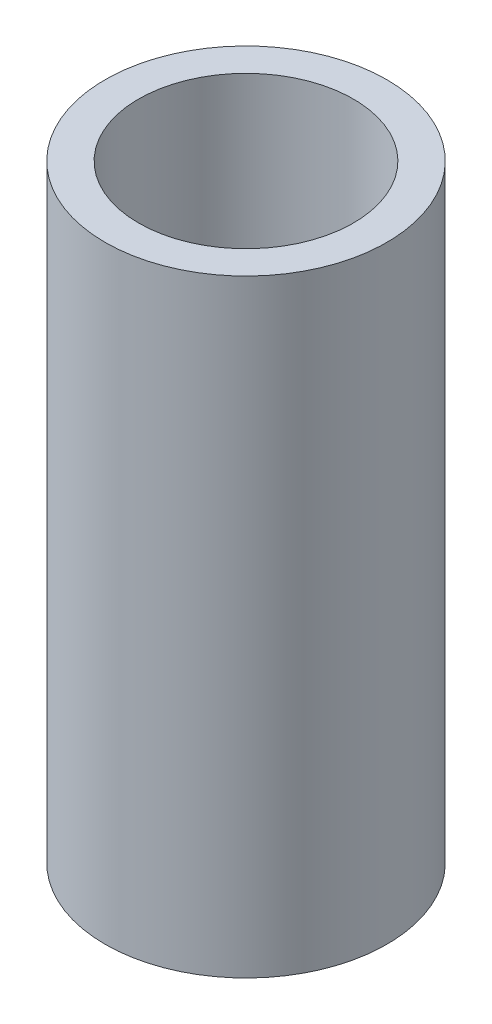
from build123d import *

# Parameters (mm, degrees)
SKETCH1_R           = 32.5
BOSS_EXTRUDE1_DEPTH = 140.209065321
SKETCH2_R           = 24.778336436
CUT_EXTRUDE1_DEPTH  = 148.550269394


with BuildPart() as part:
    # Sketch1 → Boss-Extrude1 (new body)
    with BuildSketch(Plane(origin=(0, 0, 0), x_dir=(1, 0, 0), z_dir=(0, 1, 0))):
        Circle(SKETCH1_R)
    extrude(amount=BOSS_EXTRUDE1_DEPTH)

    # Sketch2 → Cut-Extrude1 (cut, through all)
    with BuildSketch(Plane(origin=(0, 0, 0), x_dir=(1, 0, 0), z_dir=(0, 1, 0))):
        Circle(SKETCH2_R)
    extrude(amount=CUT_EXTRUDE1_DEPTH, mode=Mode.SUBTRACT)


solid = part.part
